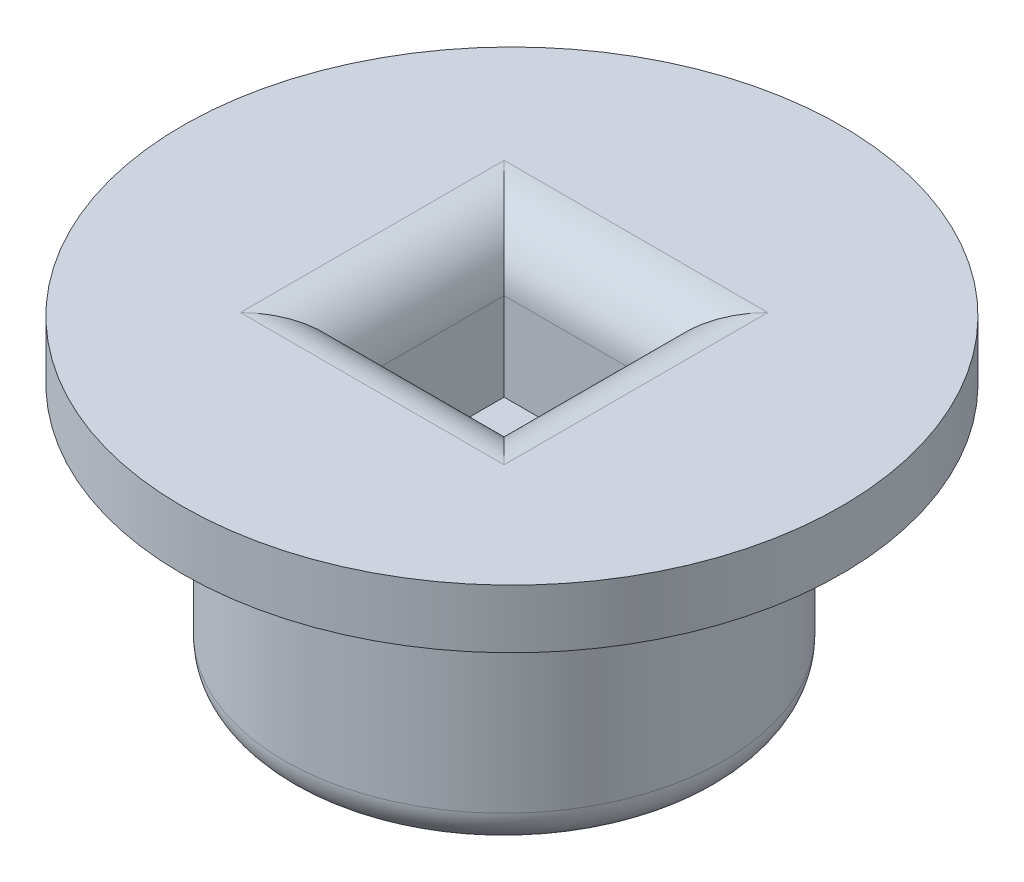
from build123d import *

# Parameters (mm, degrees)
SKETCH_1_R          = 3
EXTRUDE_1_DEPTH     = 3.5
SKETCH_2_R          = 4.5
EXTRUDE_2_DEPTH     = 0.8
SKETCH_4_W          = 2
SKETCH_4_H          = 2
CUT_EXTRUDE_1_DEPTH = 2
FILLET_1_R          = 0.5
FILLET_2_R          = 0.8


with BuildPart() as part:
    # 草图1 → 凸台-拉伸1 (new body)
    with BuildSketch(Plane(origin=(0, 0, 0), x_dir=(1, 0, 0), z_dir=(0, 1, 0))):
        Circle(SKETCH_1_R)
    extrude(amount=EXTRUDE_1_DEPTH)

    # 草图2 → 凸台-拉伸2 (add)
    with BuildSketch(Plane(origin=(0, 3.5, 0), x_dir=(1, 0, 0), z_dir=(0, 1, 0))):
        with Locations((0.094879954, 0.012027373)):
            Circle(SKETCH_2_R)
    extrude(amount=EXTRUDE_2_DEPTH)

    # 草图4 → 切除-拉伸1 (cut)
    with BuildSketch(Plane(origin=(0, 4.3, 0), x_dir=(1, 0, 0), z_dir=(0, 1, 0))):
        Rectangle(SKETCH_4_W, SKETCH_4_H)
    extrude(amount=-CUT_EXTRUDE_1_DEPTH, mode=Mode.SUBTRACT)

    # 圆角1
    fillet_1_edges = [part.edges().sort_by_distance(p)[0] for p in [
        (-3, 0, 0),
    ]]
    fillet(fillet_1_edges, radius=FILLET_1_R)

    # 圆角2
    fillet_2_edges = [part.edges().sort_by_distance(p)[0] for p in [
        (0, 4.3, 1),
        (-1, 4.3, 0),
        (0, 4.3, -1),
        (1, 4.3, 0),
    ]]
    fillet(fillet_2_edges, radius=FILLET_2_R)


solid = part.part
